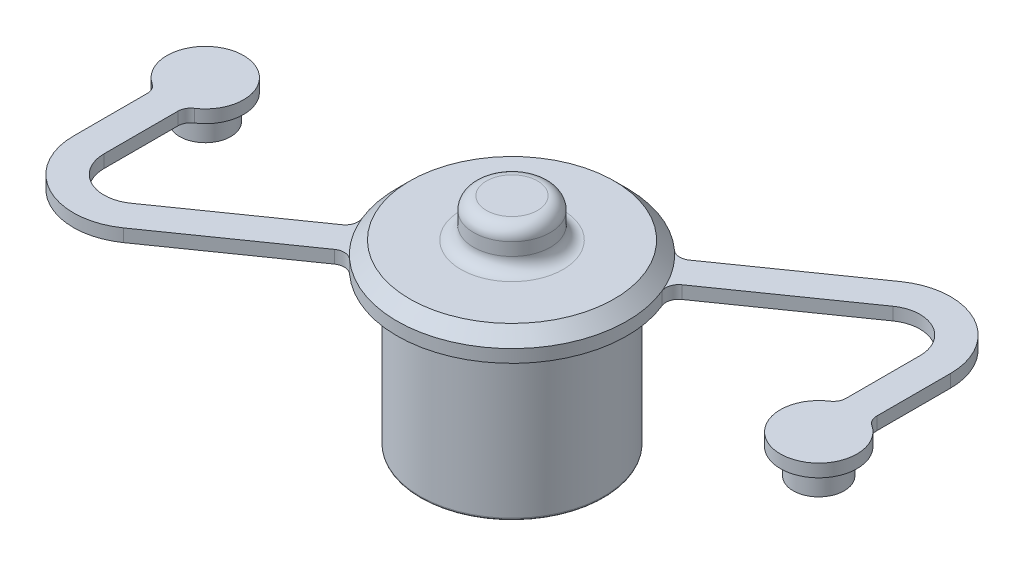
from build123d import *

# Parameters (mm, degrees)
SKETCH1_R                = 3.6
BOSS_EXTRUDE1_DEPTH      = 6
SKETCH2_R                = 4.5
BOSS_EXTRUDE2_DEPTH      = 1
EXTRUDE_THIN1_DEPTH      = 0.5
SKETCH4_R                = 1.5
BOSS_EXTRUDE3_DEPTH      = 0.5
SKETCH5_R                = 1
BOSS_EXTRUDE4_DEPTH      = 1
FILLET1_R                = 0.5
CIRPATTERN1_COUNT        = 2
FILLET1_OF_CIRPATTERN1_R = 0.5
CHAMFER1_SIZE            = 0.5
SKETCH6_R                = 1.5
BOSS_EXTRUDE5_DEPTH      = 1.5
FILLET2_R                = 0.5
FILLET3_R                = 0.1
FILLET4_R                = 0.5


with BuildPart() as part:
    # Sketch1 → Boss-Extrude1 (new body)
    with BuildSketch(Plane(origin=(0, 0, 0), x_dir=(1, 0, 0), z_dir=(0, 1, 0))):
        with Locations(Location((0, 0, 0), (0, 0, 270))):
            Circle(SKETCH1_R)
    extrude(amount=-BOSS_EXTRUDE1_DEPTH)

    # Sketch2 → Boss-Extrude2 (add)
    with BuildSketch(Plane(origin=(0, 0, 0), x_dir=(1, 0, 0), z_dir=(0, 1, 0))):
        with Locations(Location((0, 0, 0), (0, 0, 270))):
            Circle(SKETCH2_R)
    extrude(amount=BOSS_EXTRUDE2_DEPTH)

    # Sketch3 → Extrude-Thin1 (add)
    with BuildSketch(Plane(origin=(0, 0, 0), x_dir=(1, 0, 0), z_dir=(0, 1, 0))):
        with BuildLine():
            Line((0.344145862, -0.491491227), (9.196992989, 5.707339067))
            ThreePointArc((9.196992989, 5.707339067), (10.646448059, 5.802341371), (11.4, 4.560526205))
            Line((11.4, 4.560526205), (11.4, 0))
            Line((11.4, 0), (12.6, 0))
            Line((12.6, 0), (12.6, 4.560526205))
            ThreePointArc((12.6, 4.560526205), (11.200546394, 6.866754371), (8.508701265, 6.69032152))
            Line((8.508701265, 6.69032152), (-0.344145862, 0.491491227))
            Line((-0.344145862, 0.491491227), (0.344145862, -0.491491227))
        make_face()
    extrude_thin1 = extrude(amount=EXTRUDE_THIN1_DEPTH)

    # Sketch4 → Boss-Extrude3 (add)
    with BuildSketch(Plane(origin=(0, 0, 0), x_dir=(1, 0, 0), z_dir=(0, 1, 0))):
        with Locations((12, 0)):
            Circle(SKETCH4_R)
    boss_extrude3 = extrude(amount=BOSS_EXTRUDE3_DEPTH)

    # Sketch5 → Boss-Extrude4 (add)
    with BuildSketch(Plane(origin=(0, 0, 0), x_dir=(1, 0, 0), z_dir=(0, 1, 0))):
        with Locations(Location((12, 0, 0), (0, 0, 270))):
            Circle(SKETCH5_R)
    boss_extrude4 = extrude(amount=-BOSS_EXTRUDE4_DEPTH)

    # Fillet1
    fillet1_edges = [part.edges().sort_by_distance(p)[0] for p in [
        (3.997417043, 0.25, -2.066556794),
        (3.30912532, 0.25, -3.049539247),
        (11.4, 0.25, -1.374772708),
        (12.6, 0.25, -1.374772708),
    ]]
    fillet(fillet1_edges, radius=FILLET1_R)

    # CirPattern1: Extrude-Thin1, Boss-Extrude3, Boss-Extrude4 ×2 about axis
    cirpattern1_axis = Axis((0, 0, 0), (0, 1, 0))
    add([extrude_thin1.rotate(cirpattern1_axis, i * 360 / CIRPATTERN1_COUNT) for i in range(1, CIRPATTERN1_COUNT)])
    add([boss_extrude3.rotate(cirpattern1_axis, i * 360 / CIRPATTERN1_COUNT) for i in range(1, CIRPATTERN1_COUNT)])
    add([boss_extrude4.rotate(cirpattern1_axis, i * 360 / CIRPATTERN1_COUNT) for i in range(1, CIRPATTERN1_COUNT)])

    # Fillet1 of CirPattern1
    fillet1_of_cirpattern1_edges = [part.edges().sort_by_distance(p)[0] for p in [
        (-3.997417043, 0.25, 2.066556794),
        (-3.30912532, 0.25, 3.049539247),
        (-11.4, 0.25, 1.374772708),
        (-12.6, 0.25, 1.374772708),
    ]]
    fillet(fillet1_of_cirpattern1_edges, radius=FILLET1_OF_CIRPATTERN1_R)

    # Chamfer1
    chamfer1_edges = [part.edges().sort_by_distance(p)[0] for p in [
        (0, 1, -4.5),
    ]]
    chamfer(chamfer1_edges, length=CHAMFER1_SIZE - 0.0001)  # a hair under: the kernel refuses the full size

    # Sketch6 → Boss-Extrude5 (add)
    with BuildSketch(Plane(origin=(0, 1, 0), x_dir=(1, 0, 0), z_dir=(0, 1, 0))):
        with Locations(Location((0, 0, 0), (0, 0, 270))):
            Circle(SKETCH6_R)
    extrude(amount=BOSS_EXTRUDE5_DEPTH)

    # Fillet2
    fillet2_edges = [part.edges().sort_by_distance(p)[0] for p in [
        (0, 2.5, -1.5),
    ]]
    fillet(fillet2_edges, radius=FILLET2_R)

    # Sketch7 → Cut-Revolve1 (revolve, cut)
    with BuildSketch(Plane(origin=(0, 0, 0), x_dir=(0, 0, -1), z_dir=(1, 0, 0)), mode=Mode.PRIVATE) as cut_revolve1_sk:
        with BuildLine():
            Line((0, -6), (0, -5.673332204))
            ThreePointArc((0, -5.673332204), (-1.807395353, -5.755166574), (-3.6, -6))
            Line((-3.6, -6), (0, -6))
        make_face()
    revolve(cut_revolve1_sk.sketch.rotate(Axis((0, -6, 0), (0, 1, 0)), 137.709032994), axis=Axis((0, -6, 0), (0, 1, 0)), mode=Mode.SUBTRACT)

    # Fillet3
    fillet3_edges = [part.edges().sort_by_distance(p)[0] for p in [
        (-3.357602864, -6, -1.298654307),
    ]]
    fillet(fillet3_edges, radius=FILLET3_R)

    # Fillet4
    fillet4_edges = [part.edges().sort_by_distance(p)[0] for p in [
        (0, 1, -1.5),
    ]]
    fillet(fillet4_edges, radius=FILLET4_R)


solid = part.part
